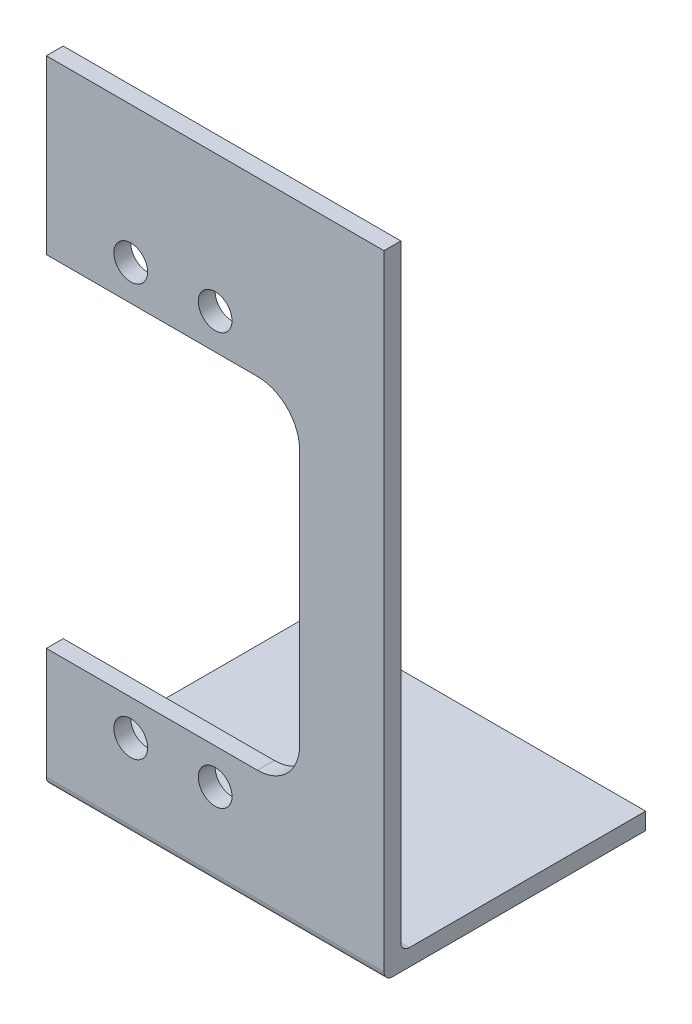
from build123d import *

# Parameters (mm, degrees)
SKETCH1_W                   = 40
SKETCH1_H                   = 30
BOSS_EXTRUDE1_DEPTH         = 2
BOSS_EXTRUDE2_DEPTH         = 73
BOSS_EXTRUDE2_DEPTH_BACK    = 2
SKETCH2_W                   = 40
SKETCH2_H                   = 2
FILLET1_R                   = 1
M3_TAPPED_HOLE1_D           = 2.5
M3_TAPPED_HOLE1_CSINK_D     = 3.05
M3_TAPPED_HOLE1_CSINK_ANGLE = 90
SKETCH11_R                  = 2
SKETCH11_W                  = 30
SKETCH11_H                  = 40.4
CUT_EXTRUDE5_DEPTH          = 2
FILLET3_R                   = 5


with BuildPart() as part:
    # Sketch1 → Boss-Extrude1 (new body)
    with BuildSketch(Plane(origin=(0, 0, 0), x_dir=(1, 0, 0), z_dir=(0, 1, 0))):
        with Locations((20, 15)):
            Rectangle(SKETCH1_W, SKETCH1_H)
    extrude(amount=BOSS_EXTRUDE1_DEPTH)

    # Sketch2 → Boss-Extrude2 (add, two sides: drawn at the far end of the back side and taken through both)
    with BuildSketch(Plane(origin=(0, 2, 0), x_dir=(1, 0, 0), z_dir=(0, 1, 0)).offset(-BOSS_EXTRUDE2_DEPTH_BACK)):
        with Locations((20, 0)):
            Rectangle(SKETCH2_W, SKETCH2_H)
    extrude(amount=BOSS_EXTRUDE2_DEPTH + BOSS_EXTRUDE2_DEPTH_BACK)

    # Fillet1
    fillet1_edges = [part.edges().sort_by_distance(p)[0] for p in [
        (20, 0, 1),
        (20, 2, -1),
    ]]
    fillet(fillet1_edges, radius=FILLET1_R)

    # M3 Tapped Hole1 (through all)
    with Locations(Plane(origin=(0, 2, 0), x_dir=(1, 0, 0), z_dir=(0, 1, 0))):
        with Locations((20, 15)):
            CounterSinkHole(M3_TAPPED_HOLE1_D / 2, M3_TAPPED_HOLE1_CSINK_D / 2, counter_sink_angle=M3_TAPPED_HOLE1_CSINK_ANGLE)

    # Sketch11 → Cut-Extrude5 (cut)
    with BuildSketch(Plane.XY.offset(1)):
        with Locations((10, 58.8)):
            Circle(SKETCH11_R)
        with Locations((20, 58.8)):
            Circle(SKETCH11_R)
        with Locations((15, 34.4)):
            Rectangle(SKETCH11_W, SKETCH11_H)
        with Locations((10, 10)):
            Circle(SKETCH11_R)
        with Locations((20, 10)):
            Circle(SKETCH11_R)
    extrude(amount=-CUT_EXTRUDE5_DEPTH, mode=Mode.SUBTRACT)

    # Fillet3
    fillet3_edges = [part.edges().sort_by_distance(p)[0] for p in [
        (30, 14.2, 0),
        (30, 54.6, 0),
    ]]
    fillet(fillet3_edges, radius=FILLET3_R)


solid = part.part
